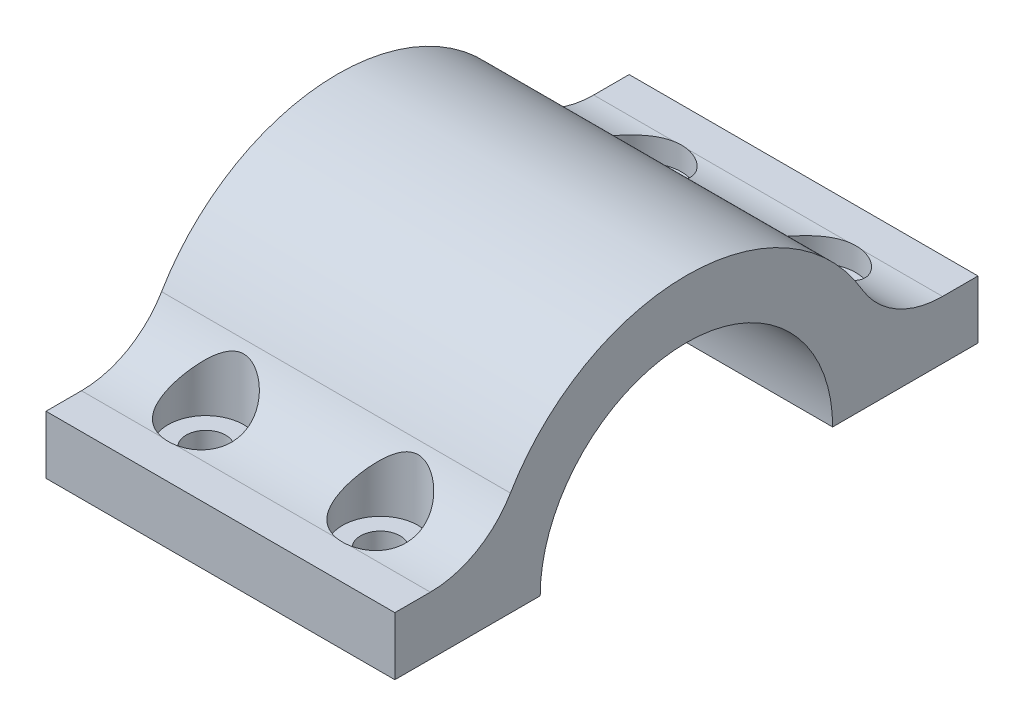
from build123d import *
from build123d.topology import SkipClean

# Parameters (mm, degrees)
BOSS_EXTRUDE1_DEPTH           = 15
CBORE_FOR_M3_SHCS1_AT_2_COUNT = 2
CBORE_FOR_M3_SHCS1_AT_2_PITCH = 15
FILLET1_START                 = -15
FILLET1_DEPTH                 = 30
FILLET1_START_2               = 5
FILLET1_2_OUTLINE_R           = 3.25
FILLET1_2_DEPTH               = 3.266781676


with BuildPart() as part:
    # Sketch1 → Boss-Extrude1 (new, symmetric)
    with BuildSketch(Plane(origin=(0, 0, 0), x_dir=(0, 0, -1), z_dir=(1, 0, 0))):
        with BuildLine():
            Line((-12.575, 0), (-25.075, 0))
            Line((-25.075, 0), (-25.075, 5))
            Line((-25.075, 5), (-16.848757373, 5))
            ThreePointArc((-16.848757373, 5), (0, 17.575), (16.848757373, 5))
            Line((16.848757373, 5), (25.075, 5))
            Line((25.075, 5), (25.075, 0))
            Line((25.075, 0), (12.575, 0))
            ThreePointArc((12.575, 0), (0, 12.575), (-12.575, 0))
        make_face()
    extrude(amount=BOSS_EXTRUDE1_DEPTH, both=True)

    # Sketch4 → CBORE for M3 SHCS1 (revolve, cut)
    with BuildSketch(Plane(origin=(7.5, 0, 18.825), x_dir=(0, 0, -1), z_dir=(1, 0, 0))):
        Polygon((0, 0), (0, 17.575), (3.25, 17.575), (3.25, 3), (1.7, 3), (1.7, 0), align=None)
    cbore_for_m3_shcs1 = revolve(axis=Axis((7.5, -6.35, 18.825), (0, 1, 0)), mode=Mode.SUBTRACT)

    # CBORE for M3 SHCS1 at 2: CBORE for M3 SHCS1 ×2
    with Locations(*[(-i * CBORE_FOR_M3_SHCS1_AT_2_PITCH, 0, 0) for i in range(1, CBORE_FOR_M3_SHCS1_AT_2_COUNT)]):
        add(cbore_for_m3_shcs1, mode=Mode.SUBTRACT)

    # Mirror1: CBORE for M3 SHCS1 across plane
    add(cbore_for_m3_shcs1.mirror(Plane.XY), mode=Mode.SUBTRACT)

    # Mirror1 copy 1 sketch → Mirror1 copy 1 (revolve, cut)
    with BuildSketch(Plane(origin=(-7.5, 0, -18.825), x_dir=(0, 0, 1), z_dir=(1, 0, 0))):
        Polygon((0, 0), (0, -17.575), (3.25, -17.575), (3.25, -3), (1.7, -3), (1.7, 0), align=None)
    revolve(axis=Axis((-7.5, -6.35, -18.825), (0, -1, 0)), mode=Mode.SUBTRACT)

    # Fillet1: read off the stored shape, not the designer's step
    # Fillet1 outline → Fillet1 (add)
    with BuildSketch(Plane.YZ.offset(FILLET1_START)):
        with BuildLine():
            Line((5, -16.848757373), (5, -22.024545966))
            ThreePointArc((5, -22.024545966), (6.052634697, -18.057920782), (8.933528837, -15.135147423))
            ThreePointArc((8.933528837, -15.135147423), (7.019253609, -16.112439411), (5, -16.848757373))
        make_face()
        with BuildLine():
            ThreePointArc((5, 16.848757373), (7.019253609, 16.112439411), (8.933528837, 15.135147423))
            ThreePointArc((8.933528837, 15.135147423), (6.052634697, 18.057920782), (5, 22.024545966))
            Line((5, 22.024545966), (5, 16.848757373))
        make_face()
    extrude(amount=FILLET1_DEPTH)

    # Fillet1 2 outline → Fillet1 2 (cut)
    with SkipClean():  # the faces are left unmerged after this step: merging them gives an invalid solid
        with BuildSketch(Plane(origin=(0, 0, 0), x_dir=(1, 0, 0), z_dir=(0, 1, 0)).offset(FILLET1_START_2)):
            with Locations((7.5, 18.825)):
                Circle(FILLET1_2_OUTLINE_R)
            with Locations((-7.5, 18.825)):
                Circle(FILLET1_2_OUTLINE_R)
            with Locations((7.5, -18.825)):
                Circle(FILLET1_2_OUTLINE_R)
            with Locations((-7.5, -18.825)):
                Circle(FILLET1_2_OUTLINE_R)
        extrude(amount=FILLET1_2_DEPTH, mode=Mode.SUBTRACT)


solid = part.part
